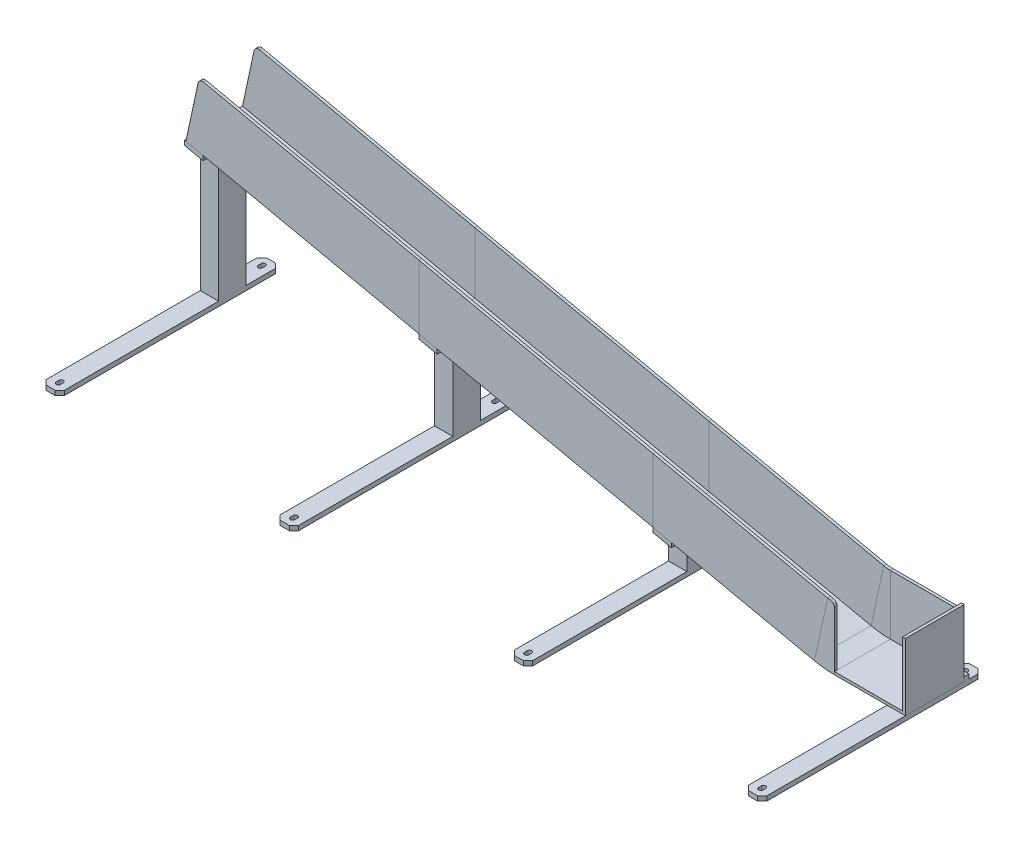
from build123d import *

# Parameters (mm, degrees)
SKETCH7_W                = 64
SKETCH7_H                = 68
BOSS_EXTRUDE1_DEPTH      = 3
SKETCH6_W                = 74.331458044
SKETCH6_H                = 65
CUT_EXTRUDE1_DEPTH       = 10
FILLET1_R                = 5
SKETCH8_W                = 3
SKETCH8_H                = 64
BOSS_EXTRUDE2_DEPTH      = 5
SKETCH9_W                = 20
SKETCH9_H                = 240
BOSS_EXTRUDE3_DEPTH      = 5
M4_START                 = -8
M4_CLEARANCE_SLOT1_DEPTH = 5
CHAMFER1_SIZE            = 5
BOSS_EXTRUDE5_START      = -22
SKETCH11_W               = 5
SKETCH11_H               = 5
BOSS_EXTRUDE5_DEPTH      = 196
LPATTERN1_COUNT          = 4
LPATTERN1_PITCH          = 255
BOSS_EXTRUDE4_DEPTH      = 15
BOSS_EXTRUDE4_2_DEPTH    = 15
BOSS_EXTRUDE4_3_DEPTH    = 15
SPLIT1_START             = -780.632908888
SPLIT1_DEPTH             = 508.632908888
SPLIT1_START_2           = -74.331458044
SPLIT1_2_OUTLINE_W       = 73
SPLIT1_2_OUTLINE_H       = 64
SPLIT1_2_DEPTH           = 77.331458044
SPLIT1_START_3           = -32
SPLIT1_3_DEPTH           = 3
SPLIT1_START_4           = 29
SPLIT1_4_DEPTH           = 3
SPLIT1_START_5           = -29
SPLIT1_5_DEPTH           = 58
SPLIT1_6_DEPTH           = 3
SPLIT1_7_DEPTH           = 3
SPLIT1_8_DEPTH           = 58
SPLIT1_START_6           = -3
SPLIT1_9_DEPTH           = 68
SPLIT1_10_OUTLINE_W      = 74.331458044
SPLIT1_10_OUTLINE_H      = 61
SPLIT1_10_DEPTH          = 3
SPLIT1_START_7           = 65
SPLIT1_11_OUTLINE_W      = 3
SPLIT1_11_OUTLINE_H      = 64
SPLIT1_11_DEPTH          = 5
SKETCH12_W               = 20.460512602
SKETCH12_H               = 64
BOSS_EXTRUDE6_DEPTH      = 5
BOSS_EXTRUDE6_2_DEPTH    = 5
SKETCH12_W_2             = 20.460512603
BOSS_EXTRUDE6_3_DEPTH    = 5
SKETCH13_W               = 20
SKETCH13_H               = 5
BOSS_EXTRUDE7_DEPTH      = 5


# Read off the part's stored shape, not the designer's step: M4 Clearance Slot1, Split1
with BuildPart() as part:
    # Sweep1: sweep along a path in Sketch2
    with BuildLine(Plane.XY) as sweep1_path:
        Line((0, 0), (-74.331458044, 0))
        ThreePointArc((-74.331458044, 0), (-84.939799911, 0.564276626), (-95.428420991, 2.250738343))
        Line((-95.428420991, 2.250738343), (-780, 150))
    # Sketch1 → Sweep1 (sweep)
    with BuildSketch(Plane(origin=(0, 0, 0), x_dir=(0, 0, -1), z_dir=(1, 0, 0))):
        Polygon((-29, 0), (29, 0), (29, 65), (32, 65), (32, -3), (-32, -3), (-32, 65), (-29, 65), align=None)
    sweep(path=sweep1_path.line)

    # Sketch7 → Boss-Extrude1 (add)
    with BuildSketch(Plane(origin=(0, 0, 0), x_dir=(0, 0, -1), z_dir=(1, 0, 0))):
        with Locations((0, 31)):
            Rectangle(SKETCH7_W, SKETCH7_H)
    extrude(amount=BOSS_EXTRUDE1_DEPTH)

    # Sketch6 → Cut-Extrude1 (cut)
    with BuildSketch(Plane.XY.offset(32)):
        with Locations((-37.165729022, 32.5)):
            Rectangle(SKETCH6_W, SKETCH6_H)
    extrude(amount=-CUT_EXTRUDE1_DEPTH, mode=Mode.SUBTRACT)

    # Fillet1
    fillet1_edges = [part.edges().sort_by_distance(p)[0] for p in [
        (-766.286974084, 213.537020077, -30.5),
        (-766.286974084, 213.537020077, 30.5),
        (-74.331458044, 65, 30.5),
    ]]
    fillet(fillet1_edges, radius=FILLET1_R)

    # Sketch8 → Boss-Extrude2 (add)
    with BuildSketch(Plane(origin=(0, 65, 0), x_dir=(1, 0, 0), z_dir=(0, 1, 0))):
        with Locations((1.5, 0)):
            Rectangle(SKETCH8_W, SKETCH8_H)
    extrude(amount=BOSS_EXTRUDE2_DEPTH)

    # Split1 outline → Split1 (cut)
    with BuildSketch(Plane.YZ.offset(SPLIT1_START)):
        Polygon((214, -32), (214, 32), (0, 32), (0, -29), (-3, -29), (-3, -32), align=None)
    extrude(amount=SPLIT1_DEPTH, mode=Mode.SUBTRACT)

    # Split1 2 outline → Split1 2 (cut)
    with BuildSketch(Plane.YZ.offset(SPLIT1_START_2)):
        with Locations((33.5, 0)):
            Rectangle(SPLIT1_2_OUTLINE_W, SPLIT1_2_OUTLINE_H)
    extrude(amount=SPLIT1_2_DEPTH, mode=Mode.SUBTRACT)


with BuildPart() as body_2:
    # Sketch9 → Boss-Extrude3 (new body)
    with BuildSketch(Plane.XZ.offset(3)):
        with Locations((-7, 68)):
            Rectangle(SKETCH9_W, SKETCH9_H)
    extrude(amount=BOSS_EXTRUDE3_DEPTH)

    # M4 Clearance Slot1 outline → M4 Clearance Slot1 (cut)
    with BuildSketch(Plane(origin=(0, 0, 0), x_dir=(1, 0, 0), z_dir=(0, 1, 0)).offset(M4_START)):
        with BuildLine():
            Line((-4.6, -179.5), (-4.6, -176.5))
            ThreePointArc((-4.6, -176.5), (-7, -174.1), (-9.4, -176.5))
            Line((-9.4, -176.5), (-9.4, -179.5))
            ThreePointArc((-9.4, -179.5), (-7, -181.9), (-4.6, -179.5))
        make_face()
        with BuildLine():
            ThreePointArc((-4.6, 43.5), (-7, 45.9), (-9.4, 43.5))
            Line((-9.4, 43.5), (-9.4, 40.5))
            ThreePointArc((-9.4, 40.5), (-7, 38.1), (-4.6, 40.5))
            Line((-4.6, 40.5), (-4.6, 43.5))
        make_face()
    extrude(amount=M4_CLEARANCE_SLOT1_DEPTH, mode=Mode.SUBTRACT)

    # Chamfer1
    chamfer1_edges = [body_2.edges().sort_by_distance(p)[0] for p in [
        (3, -5.5, -52),
        (-17, -5.5, -52),
        (-17, -5.5, 188),
        (3, -5.5, 188),
    ]]
    chamfer(chamfer1_edges, length=CHAMFER1_SIZE)

    # Sketch11 → Boss-Extrude5 (add)
    with BuildSketch(Plane.XY.offset(188).offset(BOSS_EXTRUDE5_START)):
        with Locations((-7, -10.5)):
            Rectangle(SKETCH11_W, SKETCH11_H)
    extrude(amount=-BOSS_EXTRUDE5_DEPTH)


with BuildPart() as lpattern1_1:
    # LPattern1: pattern copy
    add(body_2.part.moved(Location(Vector(-1, 0, 0) * (1 * LPATTERN1_PITCH))))


with BuildPart() as lpattern1_2:
    # LPattern1: pattern copy
    add(body_2.part.moved(Location(Vector(-1, 0, 0) * (2 * LPATTERN1_PITCH))))


with BuildPart() as lpattern1_3:
    # LPattern1: pattern copy
    add(body_2.part.moved(Location(Vector(-1, 0, 0) * (3 * LPATTERN1_PITCH))))


with BuildPart() as body_6:
    # Sketch10 → Boss-Extrude4 (new, symmetric)
    with BuildSketch(Plane.XY):
        Polygon((-782, -3), (-782, 147.362577786), (-762, 143.046031023), (-762, -3), align=None)
    extrude(amount=BOSS_EXTRUDE4_DEPTH, both=True)


with BuildPart() as body_7:
    # Sketch10 → Boss-Extrude4 2 (new, symmetric)
    with BuildSketch(Plane.XY):
        Polygon((-527, -3), (-507, -3), (-507, 88.0100598), (-527, 92.326606563), align=None)
    extrude(amount=BOSS_EXTRUDE4_2_DEPTH, both=True)


with BuildPart() as body_8:
    # Sketch10 → Boss-Extrude4 3 (new, symmetric)
    with BuildSketch(Plane.XY):
        Polygon((-252, -3), (-272, -3), (-272, 37.29063534), (-252, 32.974088577), align=None)
    extrude(amount=BOSS_EXTRUDE4_3_DEPTH, both=True)


with BuildPart() as body_9:
    # Split1 3 outline → Split1 3 (new body)
    with BuildSketch(Plane.XY.offset(SPLIT1_START_3)):
        with BuildLine():
            Line((-527, 161.892349411), (-761.399511001, 212.482171929))
            ThreePointArc((-761.399511001, 212.482171929), (-765.164427159, 211.796557413), (-767.341822232, 208.649556994))
            Line((-767.341822232, 208.649556994), (-780.632908888, 147.06752215))
            Line((-780.632908888, 147.06752215), (-527, 92.326606563))
            Line((-527, 92.326606563), (-527, 161.892349411))
        make_face()
    extrude(amount=SPLIT1_3_DEPTH)

    # Split1 4 outline → Split1 4 (add)
    with BuildSketch(Plane.XY.offset(SPLIT1_START_4)):
        with BuildLine():
            Line((-527, 161.892349411), (-761.399511001, 212.482171929))
            ThreePointArc((-761.399511001, 212.482171929), (-765.164427159, 211.796557413), (-767.341822232, 208.649556994))
            Line((-767.341822232, 208.649556994), (-780.632908888, 147.06752215))
            Line((-780.632908888, 147.06752215), (-527, 92.326606563))
            Line((-527, 92.326606563), (-527, 161.892349411))
        make_face()
    extrude(amount=SPLIT1_4_DEPTH)

    # Split1 5 outline → Split1 5 (add)
    with BuildSketch(Plane.XY.offset(SPLIT1_START_5)):
        Polygon((-527, 92.326606563), (-527, 95.395683453), (-780, 150), (-780.632908888, 147.06752215), align=None)
    extrude(amount=SPLIT1_5_DEPTH)


with BuildPart() as body_10:
    # Split1 6 outline → Split1 6 (new body)
    with BuildSketch(Plane.XY.offset(SPLIT1_START_3)):
        Polygon((-272, 106.856378188), (-527, 161.892349411), (-527, 92.326606563), (-272, 37.29063534), align=None)
    extrude(amount=SPLIT1_6_DEPTH)

    # Split1 7 outline → Split1 7 (add)
    with BuildSketch(Plane.XY.offset(SPLIT1_START_4)):
        Polygon((-272, 106.856378188), (-527, 161.892349411), (-527, 92.326606563), (-272, 37.29063534), align=None)
    extrude(amount=SPLIT1_7_DEPTH)

    # Split1 8 outline → Split1 8 (add)
    with BuildSketch(Plane.XY.offset(SPLIT1_START_5)):
        Polygon((-272, 37.29063534), (-272, 40.35971223), (-527, 95.395683453), (-527, 92.326606563), align=None)
    extrude(amount=SPLIT1_8_DEPTH)


with BuildPart() as body_11:
    # Split1 9 outline → Split1 9 (new body)
    with BuildSketch(Plane(origin=(0, 0, 0), x_dir=(1, 0, 0), z_dir=(0, 1, 0)).offset(SPLIT1_START_6)):
        Polygon((-74.331458044, 32), (-74.331458044, 29), (0, 29), (0, -32), (3, -32), (3, 32), align=None)
    extrude(amount=SPLIT1_9_DEPTH)

    # Split1 10 outline → Split1 10 (add)
    with BuildSketch(Plane(origin=(0, 0, 0), x_dir=(1, 0, 0), z_dir=(0, 1, 0)).offset(SPLIT1_START_6)):
        with Locations((-37.165729022, -1.5)):
            Rectangle(SPLIT1_10_OUTLINE_W, SPLIT1_10_OUTLINE_H)
    extrude(amount=SPLIT1_10_DEPTH)

    # Split1 11 outline → Split1 11 (add)
    with BuildSketch(Plane(origin=(0, 0, 0), x_dir=(1, 0, 0), z_dir=(0, 1, 0)).offset(SPLIT1_START_7)):
        with Locations((1.5, 0)):
            Rectangle(SPLIT1_11_OUTLINE_W, SPLIT1_11_OUTLINE_H)
    extrude(amount=SPLIT1_11_DEPTH)


with BuildPart() as body_12:
    # Sketch12 → Boss-Extrude6 (new, along a direction that is not the sketch's normal)
    with BuildSketch(Plane(origin=(-4.416104576, -20.461284536, 0), x_dir=(0.9774926165651558, -0.2109696294744938, 0), z_dir=(-0.21096962947449382, -0.977492616565156, 0))):
        with Locations((-524.386462606, 0)):
            Rectangle(SKETCH12_W, SKETCH12_H)
    extrude(amount=BOSS_EXTRUDE6_DEPTH, dir=(0, -1, 0))


with BuildPart() as body_13:
    # Sketch12 → Boss-Extrude6 2 (new, along a direction that is not the sketch's normal)
    with BuildSketch(Plane(origin=(-4.416104576, -20.461284536, 0), x_dir=(0.9774926165651558, -0.2109696294744938, 0), z_dir=(-0.21096962947449382, -0.977492616565156, 0))):
        with Locations((-263.514926925, 0)):
            Rectangle(SKETCH12_W, SKETCH12_H)
    extrude(amount=BOSS_EXTRUDE6_2_DEPTH, dir=(0, -1, 0))


with BuildPart() as body_14:
    # Sketch12 → Boss-Extrude6 3 (new, along a direction that is not the sketch's normal)
    with BuildSketch(Plane(origin=(-4.416104576, -20.461284536, 0), x_dir=(0.9774926165651558, -0.2109696294744938, 0), z_dir=(-0.21096962947449382, -0.977492616565156, 0))):
        with Locations((-785.257998286, 0)):
            Rectangle(SKETCH12_W_2, SKETCH12_H)
    extrude(amount=BOSS_EXTRUDE6_3_DEPTH, dir=(0, -1, 0))


with BuildPart() as body_6_1:
    add(body_6.part)

    # Combine1: union LPattern1_3, body 14
    add(lpattern1_3.part)
    add(body_14.part)


with BuildPart() as body_7_1:
    add(body_7.part)

    # Combine2: union LPattern1_2, body 12
    add(lpattern1_2.part)
    add(body_12.part)


with BuildPart() as body_8_1:
    add(body_8.part)

    # Combine3: union LPattern1_1, body 13
    add(lpattern1_1.part)
    add(body_13.part)


with BuildPart() as body_9_2:
    # Sketch13 → Boss-Extrude7 (new body)
    with BuildSketch(Plane(origin=(0, -3, 0), x_dir=(1, 0, 0), z_dir=(0, 1, 0))):
        with Locations((-7, 34.5)):
            Rectangle(SKETCH13_W, SKETCH13_H)
    extrude(amount=BOSS_EXTRUDE7_DEPTH)

    # Combine4: union body 2
    add(body_2.part)


solid = Compound([part.part, body_9.part, body_10.part, body_11.part, body_6_1.part, body_7_1.part, body_8_1.part, body_9_2.part])
